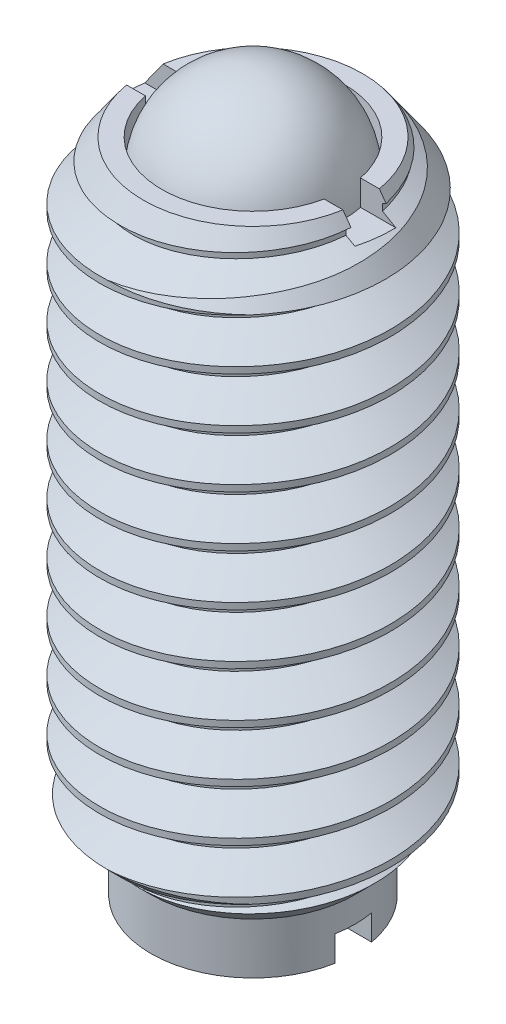
from build123d import *

# Parameters (mm, degrees)
SKETCH24_W               = 2
SKETCH24_H               = 9
CUT_SWEEP1_PITCH         = 0.7
SKETCH26_W               = 1.25
SKETCH26_H               = 8.1
CUT_EXTRUDE11_DEPTH      = 6.315073066
CUT_EXTRUDE11_DEPTH_BACK = 6.315073066
SKETCH28_W               = 0.5
SKETCH28_H               = 0.35


with BuildPart() as part:
    # Sketch24 → Revolve1 (revolve)
    with BuildSketch(Plane(origin=(0, 0, 0), x_dir=(0, 0, -1), z_dir=(1, 0, 0)), mode=Mode.PRIVATE) as revolve1_sk:
        with Locations((1, 0)):
            Rectangle(SKETCH24_W, SKETCH24_H)
    revolve(revolve1_sk.sketch.rotate(Axis((0, 4.5, 0), (0, -1, 0)), 180), axis=Axis((0, 4.5, 0), (0, -1, 0)))

    # Cut-Sweep1: the profile of Sketch38 profile screwed along a right-hand helix of 13.857143 turns, 6 arcs to a turn; built about Z, then put on its axis
    cut_sweep1_z = Axis((0, 0, 0), (0, 0, 1))
    cut_sweep1_corners = [(2.0003, 0, -0.612673205), (2.0003, 0, 0.000173205), (1.545336663, 0, -0.2625), (1.545336663, 0, -0.35)]
    with BuildLine(mode=Mode.PRIVATE) as cut_sweep1_profile:
        Line(cut_sweep1_corners[0], cut_sweep1_corners[1])
        Line(cut_sweep1_corners[1], cut_sweep1_corners[2])
        Line(cut_sweep1_corners[2], cut_sweep1_corners[3])
        Line(cut_sweep1_corners[3], cut_sweep1_corners[0])
    cut_sweep1_cap = Face(cut_sweep1_profile.wire())
    cut_sweep1_turn_angles = [0, 30, 60, 90, 120, 150, 180, 210, 240, 270, 300, 330, 360]
    cut_sweep1_turn_weights = [1, 0.8660254037844387, 1, 0.8660254037844387, 1, 0.8660254037844387, 1, 0.8660254037844387, 1, 0.8660254037844387, 1, 0.8660254037844387, 1]
    cut_sweep1_turn_rails = [Edge.make_bspline([Vector(p[0], p[1], 0).rotate(cut_sweep1_z, cut_sweep1_turn_angles[k]) / cut_sweep1_turn_weights[k] + Vector(0, 0, p[2] + CUT_SWEEP1_PITCH * cut_sweep1_turn_angles[k] / 360) for k in range(13)], [0, 0, 0, 1, 1, 2, 2, 3, 3, 4, 4, 5, 5, 6, 6, 6], 2, cut_sweep1_turn_weights) for p in cut_sweep1_corners]
    cut_sweep1_turn_sides = [Face.make_surface_from_curves(cut_sweep1_turn_rails[p[0]], cut_sweep1_turn_rails[p[1]]) for p in [(0, 1), (1, 2), (2, 3), (3, 0)]]
    cut_sweep1_last_angles = [4680, 4710, 4740, 4770, 4800, 4830, 4860, 4890, 4920, 4950, 4980, 4984.285714286, 4988.571428571]
    cut_sweep1_last_weights = [1, 0.8660254037844387, 1, 0.8660254037844387, 1, 0.8660254037844387, 1, 0.8660254037844387, 1, 0.8660254037844387, 1, 0.9972037971811945, 1]
    cut_sweep1_last_rails = [Edge.make_bspline([Vector(p[0], p[1], 0).rotate(cut_sweep1_z, cut_sweep1_last_angles[k]) / cut_sweep1_last_weights[k] + Vector(0, 0, p[2] + CUT_SWEEP1_PITCH * cut_sweep1_last_angles[k] / 360) for k in range(13)], [0, 0, 0, 1, 1, 2, 2, 3, 3, 4, 4, 5, 5, 6, 6, 6], 2, cut_sweep1_last_weights) for p in cut_sweep1_corners]
    cut_sweep1_last_sides = [Face.make_surface_from_curves(cut_sweep1_last_rails[p[0]], cut_sweep1_last_rails[p[1]]) for p in [(0, 1), (1, 2), (2, 3), (3, 0)]]
    cut_sweep1 = Plane(origin=(0, 4.5, 0), x_dir=(0, 0, 1), z_dir=(0, -1, 0)) * Solid(Shell([*[p.moved(Location((0, 0, CUT_SWEEP1_PITCH * i))) for i in range(13) for p in cut_sweep1_turn_sides], *cut_sweep1_last_sides, cut_sweep1_cap, cut_sweep1_cap.rotate(cut_sweep1_z, 4988.571428571).moved(Location((0, 0, CUT_SWEEP1_PITCH * 4988.571428571 / 360)))]))
    add(cut_sweep1, mode=Mode.SUBTRACT)

    # Sketch26 → Cut-Revolve10 (revolve, cut)
    with BuildSketch(Plane(origin=(0, 0, 0), x_dir=(0, 0, -1), z_dir=(1, 0, 0))):
        with Locations((0.625, 0.45)):
            Rectangle(SKETCH26_W, SKETCH26_H)
    revolve(axis=Axis((0, -3.6, 0), (0, 1, 0)), mode=Mode.SUBTRACT)

    # Sketch31 → Cut-Revolve13 (revolve, cut)
    with BuildSketch(Plane(origin=(0, 0, 0), x_dir=(0, 0, -1), z_dir=(1, 0, 0)), mode=Mode.PRIVATE) as cut_revolve13_sk:
        Polygon((2, -4.5), (1.4, -4.5), (1.4, -3.8), (2, -3.2), align=None)
        Polygon((2, 4.5), (1.504, 4.5), (2, 3.8), align=None)
    revolve(cut_revolve13_sk.sketch.rotate(Axis((0, 4.5, 0), (0, -1, 0)), 180), axis=Axis((0, 4.5, 0), (0, -1, 0)), mode=Mode.SUBTRACT)

    # Sketch28 → Cut-Extrude11 (cut, two sides: drawn at the far end of the back side and taken through both)
    with BuildSketch(Plane(origin=(0, 0, 0), x_dir=(0, 0, -1), z_dir=(1, 0, 0)).offset(-CUT_EXTRUDE11_DEPTH_BACK)):
        with Locations((0, -4.325)):
            Rectangle(SKETCH28_W, SKETCH28_H)
        with Locations((0, 4.325)):
            Rectangle(SKETCH28_W, SKETCH28_H)
    extrude(amount=CUT_EXTRUDE11_DEPTH + CUT_EXTRUDE11_DEPTH_BACK, mode=Mode.SUBTRACT)


with BuildPart() as body_2:
    # Sketch27 → Revolve2 (revolve)
    with BuildSketch(Plane(origin=(0, 0, 0), x_dir=(0, 0, -1), z_dir=(1, 0, 0))):
        with BuildLine():
            Line((0, 5.3), (0, 2.8))
            ThreePointArc((0, 2.8), (1.25, 4.05), (0, 5.3))
        make_face()
    revolve(axis=Axis((0, 5.3, 0), (0, -1, 0)))


solid = Compound([part.part, body_2.part])
